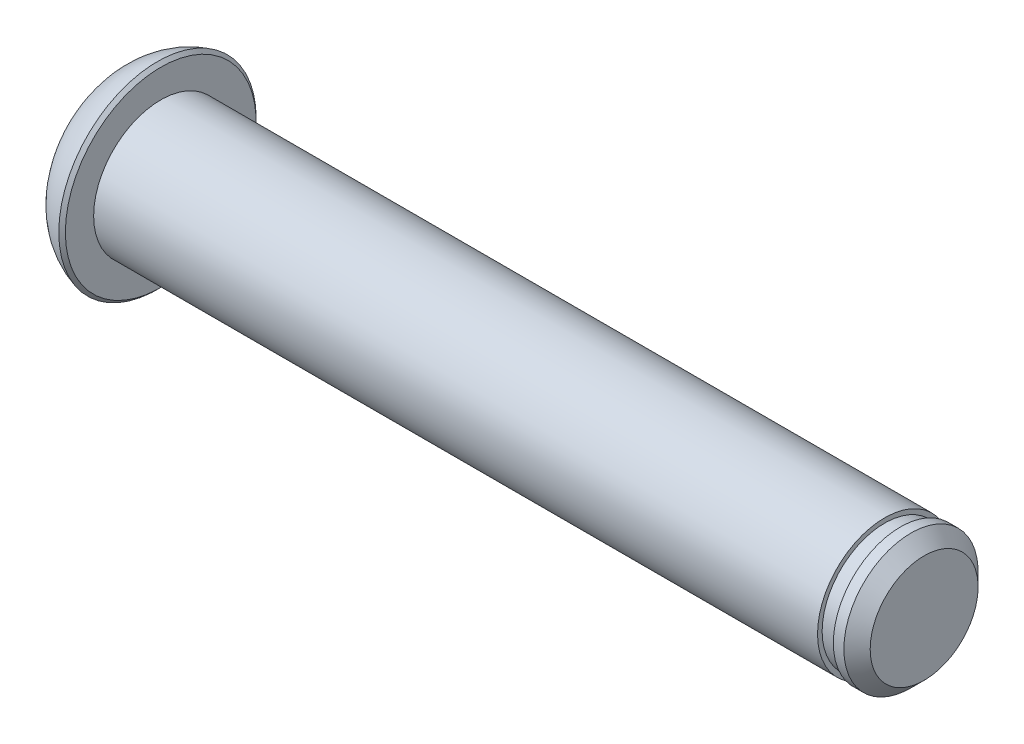
from build123d import *

# Parameters (mm, degrees)
CHAMFER_1_SIZE = 0.25
SKETCH_2_W     = 1.2
SKETCH_2_H     = 0.35
FILLET_1_R     = 5
CHAMFER_2_SIZE = 1


with BuildPart() as part:
    # Эскиз1 → Повернуть1 (revolve)
    with BuildSketch(Plane.XY, mode=Mode.PRIVATE) as revolve_1_sk:
        Polygon((0, 0), (0, 7.5), (4, 7.5), (4, 5.1), (62, 5.1), (62, 0), align=None)
    revolve(revolve_1_sk.sketch.rotate(Axis((0, 0, 0), (1, 0, 0)), 90), axis=Axis((0, 0, 0), (1, 0, 0)))

    # Фаска1
    chamfer_1_edges = [part.edges().sort_by_distance(p)[0] for p in [
        (4, 0, -7.5),
    ]]
    chamfer(chamfer_1_edges, length=CHAMFER_1_SIZE)

    # Эскиз2 → Вырез-Повернуть1 (revolve, cut)
    with BuildSketch(Plane.XY, mode=Mode.PRIVATE) as cut_revolve_1_sk:
        with Locations((59.6, 4.925)):
            Rectangle(SKETCH_2_W, SKETCH_2_H)
    revolve(cut_revolve_1_sk.sketch.rotate(Axis((0, 0, 0), (1, 0, 0)), 90), axis=Axis((0, 0, 0), (1, 0, 0)), mode=Mode.SUBTRACT)

    # Скругление1
    # the kernel refuses this fillet: 5 mm, written as the material it takes off along each edge
    with BuildSketch(Plane(origin=(0, 0, 0), x_dir=(0, 0, 1), z_dir=(0, 1, 0))) as fillet_1_piece_1:
        with BuildLine():
            CenterArc((2.658770817, 5), FILLET_1_R, 270, 75.522487814)
            Line((2.658770817, 0), (2.658770817, -0.1))
            Line((2.658770817, -0.1), (7.5, -0.1))
            Line((7.5, -0.1), (7.6, 0))
            ThreePointArc((7.6, 0), (7.6, 1.875), (7.596824584, 3.725))
            Line((7.596824584, 3.725), (7.5, 3.75))
        make_face()
    revolve(axis=Axis((0, 0, 0), (1, 0, 0)), mode=Mode.SUBTRACT)

    # Фаска2
    chamfer_2_edges = [part.edges().sort_by_distance(p)[0] for p in [
        (62, 0, -5.1),
    ]]
    chamfer(chamfer_2_edges, length=CHAMFER_2_SIZE)


solid = part.part
